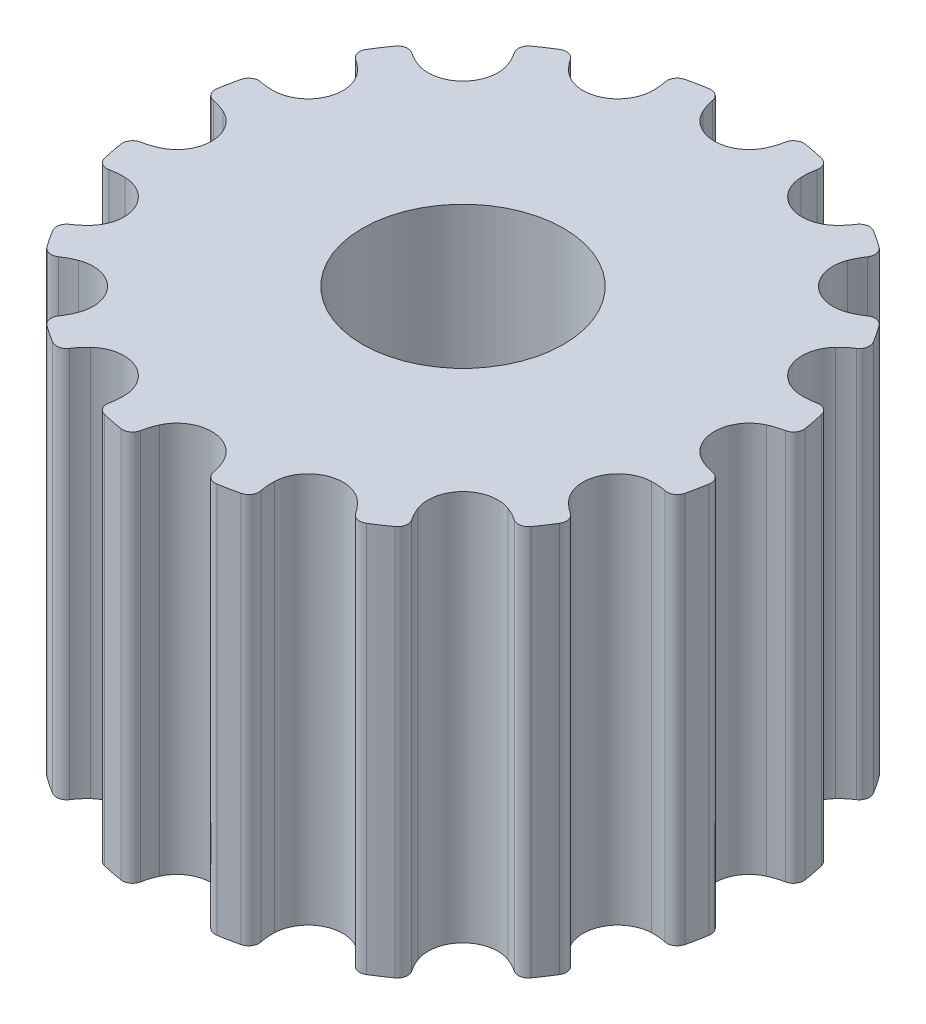
from build123d import *

# Parameters (mm, degrees)
SKETCH1_R           = 2.4511
BOSS_EXTRUDE1_DEPTH = 4.7625


with BuildPart() as part:
    # Sketch1 → Boss-Extrude1 (new, symmetric)
    with BuildSketch(Plane(origin=(0, 0, 0), x_dir=(1, 0, 0), z_dir=(0, 1, 0))):
        with BuildLine():
            ThreePointArc((-1.850768, -6.777037356), (-1.816941892, -6.962421006), (-1.663291889, -7.071521784))
            ThreePointArc((-1.663291889, -7.071521784), (-1.417233644, -7.124914669), (-1.169472895, -7.169748489))
            ThreePointArc((-1.169472895, -7.169748489), (-0.985767742, -7.127751824), (-0.883573242, -6.969424355))
            ThreePointArc((-0.883573242, -6.969424355), (-0.839120956, -6.792881518), (-0.773880597, -6.622919538))
            ThreePointArc((-0.773880597, -6.622919538), (0, -6.1245), (0.773880597, -6.622919538))
            ThreePointArc((0.773880597, -6.622919538), (0.839120956, -6.792881518), (0.883573242, -6.969424355))
            ThreePointArc((0.883573242, -6.969424355), (0.985767742, -7.127751824), (1.169472895, -7.169748489))
            ThreePointArc((1.169472895, -7.169748489), (1.417233644, -7.124914669), (1.663291889, -7.071521784))
            ThreePointArc((1.663291889, -7.071521784), (1.816941892, -6.962421006), (1.850768, -6.777037356))
            ThreePointArc((1.850768, -6.777037356), (1.824276538, -6.596921889), (1.819509137, -6.414931089))
            ThreePointArc((1.819509137, -6.414931089), (2.343744682, -5.658300197), (3.249454025, -5.822628523))
            ThreePointArc((3.249454025, -5.822628523), (3.374769892, -5.954686513), (3.483398468, -6.100779674))
            ThreePointArc((3.483398468, -6.100779674), (3.638403174, -6.20794704), (3.824196033, -6.176445981))
            ThreePointArc((3.824196033, -6.176445981), (4.035939958, -6.040210999), (4.242835561, -5.896719991))
            ThreePointArc((4.242835561, -5.896719991), (4.343038594, -5.737124705), (4.303346591, -5.552907854))
            ThreePointArc((4.303346591, -5.552907854), (4.209944466, -5.396640704), (4.135895098, -5.230327534))
            ThreePointArc((4.135895098, -5.230327534), (4.330675481, -4.330675481), (5.230327534, -4.135895098))
            ThreePointArc((5.230327534, -4.135895098), (5.396640704, -4.209944466), (5.552907854, -4.303346591))
            ThreePointArc((5.552907854, -4.303346591), (5.737124705, -4.343038594), (5.896719991, -4.242835561))
            ThreePointArc((5.896719991, -4.242835561), (6.040210999, -4.035939958), (6.176445981, -3.824196033))
            ThreePointArc((6.176445981, -3.824196033), (6.20794704, -3.638403174), (6.100779674, -3.483398468))
            ThreePointArc((6.100779674, -3.483398468), (5.954686513, -3.374769892), (5.822628523, -3.249454025))
            ThreePointArc((5.822628523, -3.249454025), (5.658300197, -2.343744682), (6.414931089, -1.819509137))
            ThreePointArc((6.414931089, -1.819509137), (6.596921889, -1.824276538), (6.777037356, -1.850768))
            ThreePointArc((6.777037356, -1.850768), (6.962421006, -1.816941892), (7.071521784, -1.663291889))
            ThreePointArc((7.071521784, -1.663291889), (7.124914669, -1.417233644), (7.169748489, -1.169472895))
            ThreePointArc((7.169748489, -1.169472895), (7.127751824, -0.985767742), (6.969424355, -0.883573242))
            ThreePointArc((6.969424355, -0.883573242), (6.792881518, -0.839120956), (6.622919538, -0.773880597))
            ThreePointArc((6.622919538, -0.773880597), (6.1245, 0), (6.622919538, 0.773880597))
            ThreePointArc((6.622919538, 0.773880597), (6.792881518, 0.839120956), (6.969424355, 0.883573242))
            ThreePointArc((6.969424355, 0.883573242), (7.127751824, 0.985767742), (7.169748489, 1.169472895))
            ThreePointArc((7.169748489, 1.169472895), (7.124914669, 1.417233644), (7.071521784, 1.663291889))
            ThreePointArc((7.071521784, 1.663291889), (6.962421006, 1.816941892), (6.777037356, 1.850768))
            ThreePointArc((6.777037356, 1.850768), (6.596921889, 1.824276538), (6.414931089, 1.819509137))
            ThreePointArc((6.414931089, 1.819509137), (5.658300197, 2.343744682), (5.822628523, 3.249454025))
            ThreePointArc((5.822628523, 3.249454025), (5.954686513, 3.374769892), (6.100779674, 3.483398468))
            ThreePointArc((6.100779674, 3.483398468), (6.20794704, 3.638403174), (6.176445981, 3.824196033))
            ThreePointArc((6.176445981, 3.824196033), (6.040210999, 4.035939958), (5.896719991, 4.242835561))
            ThreePointArc((5.896719991, 4.242835561), (5.737124705, 4.343038594), (5.552907854, 4.303346591))
            ThreePointArc((5.552907854, 4.303346591), (5.396640704, 4.209944466), (5.230327534, 4.135895098))
            ThreePointArc((5.230327534, 4.135895098), (4.330675481, 4.330675481), (4.135895098, 5.230327534))
            ThreePointArc((4.135895098, 5.230327534), (4.209944466, 5.396640704), (4.303346591, 5.552907854))
            ThreePointArc((4.303346591, 5.552907854), (4.343038594, 5.737124705), (4.242835561, 5.896719991))
            ThreePointArc((4.242835561, 5.896719991), (4.035939958, 6.040210999), (3.824196033, 6.176445981))
            ThreePointArc((3.824196033, 6.176445981), (3.638403174, 6.20794704), (3.483398468, 6.100779674))
            ThreePointArc((3.483398468, 6.100779674), (3.374769892, 5.954686513), (3.249454025, 5.822628523))
            ThreePointArc((3.249454025, 5.822628523), (2.343744682, 5.658300197), (1.819509137, 6.414931089))
            ThreePointArc((1.819509137, 6.414931089), (1.824276538, 6.596921889), (1.850768, 6.777037356))
            ThreePointArc((1.850768, 6.777037356), (1.816941892, 6.962421006), (1.663291889, 7.071521784))
            ThreePointArc((1.663291889, 7.071521784), (1.417233644, 7.124914669), (1.169472895, 7.169748489))
            ThreePointArc((1.169472895, 7.169748489), (0.985767742, 7.127751824), (0.883573242, 6.969424355))
            ThreePointArc((0.883573242, 6.969424355), (0.839120956, 6.792881518), (0.773880597, 6.622919538))
            ThreePointArc((0.773880597, 6.622919538), (0, 6.1245), (-0.773880597, 6.622919538))
            ThreePointArc((-0.773880597, 6.622919538), (-0.839120956, 6.792881518), (-0.883573242, 6.969424355))
            ThreePointArc((-0.883573242, 6.969424355), (-0.985767742, 7.127751824), (-1.169472895, 7.169748489))
            ThreePointArc((-1.169472895, 7.169748489), (-1.417233644, 7.124914669), (-1.663291889, 7.071521784))
            ThreePointArc((-1.663291889, 7.071521784), (-1.816941892, 6.962421006), (-1.850768, 6.777037356))
            ThreePointArc((-1.850768, 6.777037356), (-1.824276538, 6.596921889), (-1.819509137, 6.414931089))
            ThreePointArc((-1.819509137, 6.414931089), (-2.343744682, 5.658300197), (-3.249454025, 5.822628523))
            ThreePointArc((-3.249454025, 5.822628523), (-3.374769892, 5.954686513), (-3.483398468, 6.100779674))
            ThreePointArc((-3.483398468, 6.100779674), (-3.638403174, 6.20794704), (-3.824196033, 6.176445981))
            ThreePointArc((-3.824196033, 6.176445981), (-4.035939958, 6.040210999), (-4.242835561, 5.896719991))
            ThreePointArc((-4.242835561, 5.896719991), (-4.343038594, 5.737124705), (-4.303346591, 5.552907854))
            ThreePointArc((-4.303346591, 5.552907854), (-4.209944466, 5.396640704), (-4.135895098, 5.230327534))
            ThreePointArc((-4.135895098, 5.230327534), (-4.330675481, 4.330675481), (-5.230327534, 4.135895098))
            ThreePointArc((-5.230327534, 4.135895098), (-5.396640704, 4.209944466), (-5.552907854, 4.303346591))
            ThreePointArc((-5.552907854, 4.303346591), (-5.737124705, 4.343038594), (-5.896719991, 4.242835561))
            ThreePointArc((-5.896719991, 4.242835561), (-6.040210999, 4.035939958), (-6.176445981, 3.824196033))
            ThreePointArc((-6.176445981, 3.824196033), (-6.20794704, 3.638403174), (-6.100779674, 3.483398468))
            ThreePointArc((-6.100779674, 3.483398468), (-5.954686513, 3.374769892), (-5.822628523, 3.249454025))
            ThreePointArc((-5.822628523, 3.249454025), (-5.658300197, 2.343744682), (-6.414931089, 1.819509137))
            ThreePointArc((-6.414931089, 1.819509137), (-6.596921889, 1.824276538), (-6.777037356, 1.850768))
            ThreePointArc((-6.777037356, 1.850768), (-6.962421006, 1.816941892), (-7.071521784, 1.663291889))
            ThreePointArc((-7.071521784, 1.663291889), (-7.124914669, 1.417233644), (-7.169748489, 1.169472895))
            ThreePointArc((-7.169748489, 1.169472895), (-7.127751824, 0.985767742), (-6.969424355, 0.883573242))
            ThreePointArc((-6.969424355, 0.883573242), (-6.792881518, 0.839120956), (-6.622919538, 0.773880597))
            ThreePointArc((-6.622919538, 0.773880597), (-6.1245, 0), (-6.622919538, -0.773880597))
            ThreePointArc((-6.622919538, -0.773880597), (-6.792881518, -0.839120956), (-6.969424355, -0.883573242))
            ThreePointArc((-6.969424355, -0.883573242), (-7.127751824, -0.985767742), (-7.169748489, -1.169472895))
            ThreePointArc((-7.169748489, -1.169472895), (-7.124914669, -1.417233644), (-7.071521784, -1.663291889))
            ThreePointArc((-7.071521784, -1.663291889), (-6.962421006, -1.816941892), (-6.777037356, -1.850768))
            ThreePointArc((-6.777037356, -1.850768), (-6.596921889, -1.824276538), (-6.414931089, -1.819509137))
            ThreePointArc((-6.414931089, -1.819509137), (-5.658300197, -2.343744682), (-5.822628523, -3.249454025))
            ThreePointArc((-5.822628523, -3.249454025), (-5.954686513, -3.374769892), (-6.100779674, -3.483398468))
            ThreePointArc((-6.100779674, -3.483398468), (-6.20794704, -3.638403174), (-6.176445981, -3.824196033))
            ThreePointArc((-6.176445981, -3.824196033), (-6.040210999, -4.035939958), (-5.896719991, -4.242835561))
            ThreePointArc((-5.896719991, -4.242835561), (-5.737124705, -4.343038594), (-5.552907854, -4.303346591))
            ThreePointArc((-5.552907854, -4.303346591), (-5.396640704, -4.209944466), (-5.230327534, -4.135895098))
            ThreePointArc((-5.230327534, -4.135895098), (-4.330675481, -4.330675481), (-4.135895098, -5.230327534))
            ThreePointArc((-4.135895098, -5.230327534), (-4.209944466, -5.396640704), (-4.303346591, -5.552907854))
            ThreePointArc((-4.303346591, -5.552907854), (-4.343038594, -5.737124705), (-4.242835561, -5.896719991))
            ThreePointArc((-4.242835561, -5.896719991), (-4.035939958, -6.040210999), (-3.824196033, -6.176445981))
            ThreePointArc((-3.824196033, -6.176445981), (-3.638403174, -6.20794704), (-3.483398468, -6.100779674))
            ThreePointArc((-3.483398468, -6.100779674), (-3.374769892, -5.954686513), (-3.249454025, -5.822628523))
            ThreePointArc((-3.249454025, -5.822628523), (-2.343744682, -5.658300197), (-1.819509137, -6.414931089))
            ThreePointArc((-1.819509137, -6.414931089), (-1.824276538, -6.596921889), (-1.850768, -6.777037356))
        make_face()
        Circle(SKETCH1_R, mode=Mode.SUBTRACT)
    extrude(amount=BOSS_EXTRUDE1_DEPTH, both=True)


solid = part.part
